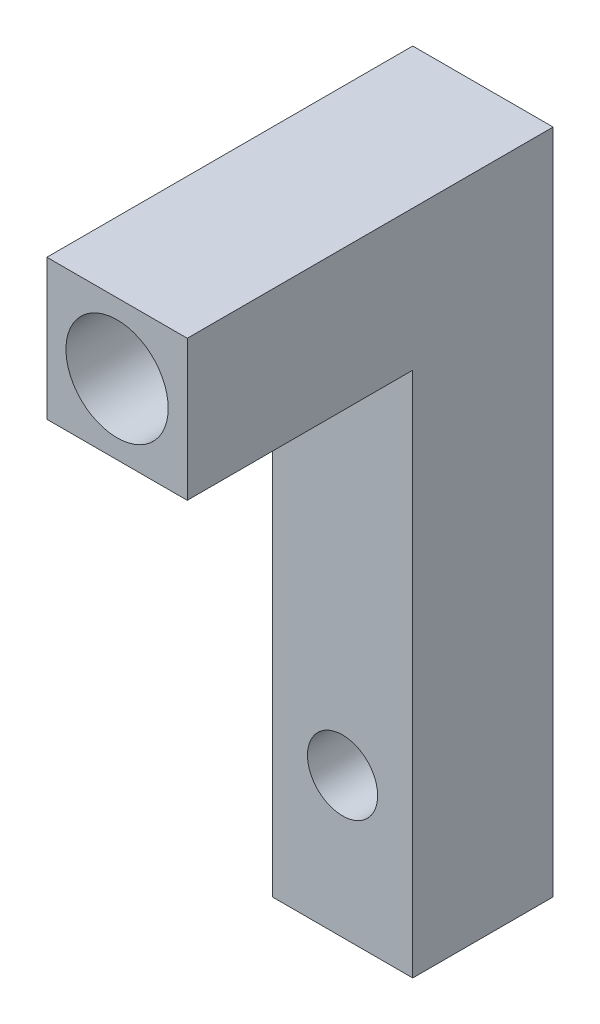
from build123d import *

# Parameters (mm, degrees)
SKETCH2_W           = 50.8
SKETCH2_H           = 50.8
BOSS_EXTRUDE1_DEPTH = 241.3
SKETCH3_R           = 12.7
CUT_EXTRUDE1_DEPTH  = 248.894110458
SKETCH4_W           = 50.8
SKETCH4_H           = 132.4
BOSS_EXTRUDE2_DEPTH = 50.8
SKETCH5_R           = 18.5
CUT_EXTRUDE2_DEPTH  = 277.406602671


with BuildPart() as part:
    # Sketch2 → Boss-Extrude1 (new body)
    with BuildSketch(Plane(origin=(0, 0, 0), x_dir=(1, 0, 0), z_dir=(0, 1, 0))):
        Rectangle(SKETCH2_W, SKETCH2_H)
    extrude(amount=BOSS_EXTRUDE1_DEPTH)

    # Sketch3 → Cut-Extrude1 (cut, through all)
    with BuildSketch(Plane.XY.offset(25.4)):
        with Locations((0, 50.8)):
            Circle(SKETCH3_R)
    extrude(amount=-CUT_EXTRUDE1_DEPTH, mode=Mode.SUBTRACT)

    # Sketch4 → Boss-Extrude2 (add)
    with BuildSketch(Plane(origin=(0, 241.3, 0), x_dir=(1, 0, 0), z_dir=(0, 1, 0))):
        with Locations((0, -40.8)):
            Rectangle(SKETCH4_W, SKETCH4_H)
    extrude(amount=-BOSS_EXTRUDE2_DEPTH)

    # Sketch5 → Cut-Extrude2 (cut, through all)
    with BuildSketch(Plane.XY.offset(107)):
        with Locations((0, 215.9)):
            Circle(SKETCH5_R)
    extrude(amount=-CUT_EXTRUDE2_DEPTH, mode=Mode.SUBTRACT)


solid = part.part
